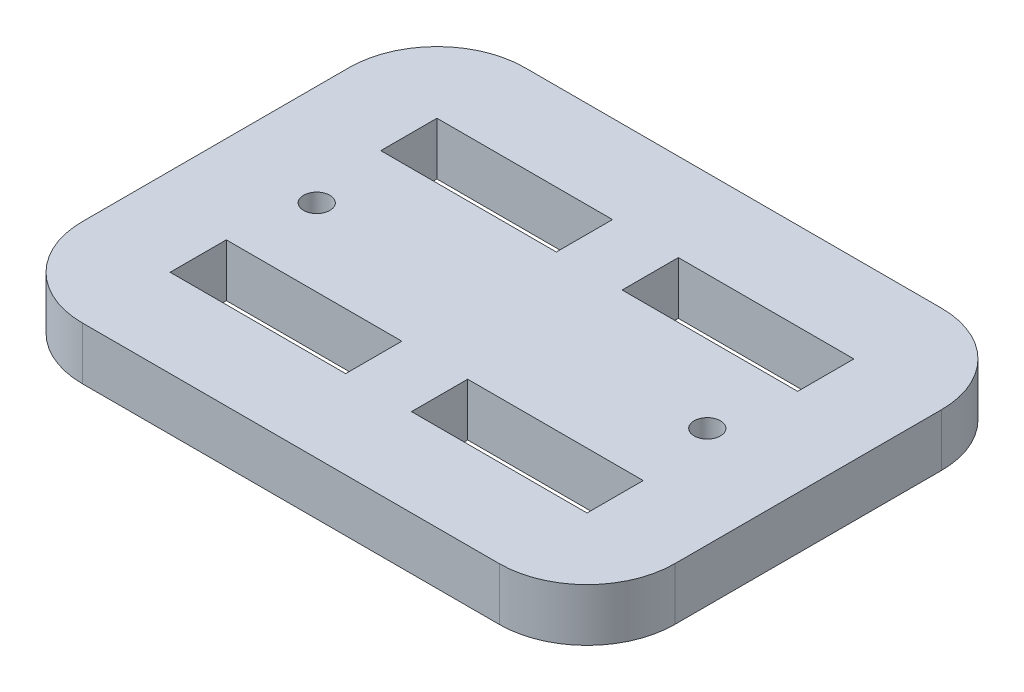
from build123d import *

# Parameters (mm, degrees)
SKETCH1_W            = 33.75
SKETCH1_H            = 50.4
SKETCH1_R            = 1.5
SKETCH1_W_2          = 20
SKETCH1_H_2          = 6.4
BOSS_EXTRUDE1_DEPTH  = 6
FILLET1_R            = 10
FILLET1_OF_MIRROR1_R = 10


with BuildPart() as part:
    # Sketch1 → Boss-Extrude1 (new body)
    with BuildSketch(Plane(origin=(0, 0, 0), x_dir=(1, 0, 0), z_dir=(0, 1, 0))):
        with Locations((-16.875, 0)):
            Rectangle(SKETCH1_W, SKETCH1_H)
        with Locations((-22.25, 0)):
            Circle(SKETCH1_R, mode=Mode.SUBTRACT)
        with Locations((-13.75, 12)):
            Rectangle(SKETCH1_W_2, SKETCH1_H_2, mode=Mode.SUBTRACT)
        with Locations((-13.75, -12)):
            Rectangle(SKETCH1_W_2, SKETCH1_H_2, mode=Mode.SUBTRACT)
    boss_extrude1 = extrude(amount=BOSS_EXTRUDE1_DEPTH)

    # Fillet1
    fillet1_edges = [part.edges().sort_by_distance(p)[0] for p in [
        (-33.75, 3, -25.2),
        (-33.75, 3, 25.2),
    ]]
    fillet(fillet1_edges, radius=FILLET1_R)

    # Mirror1: Boss-Extrude1 across plane
    add(boss_extrude1.mirror(Plane(origin=(0, 6, -25.2), x_dir=(0, 0, 1), z_dir=(-1, 0, 0))))

    # Fillet1 of Mirror1
    fillet1_of_mirror1_edges = [part.edges().sort_by_distance(p)[0] for p in [
        (33.75, 3, -25.2),
        (33.75, 3, 25.2),
    ]]
    fillet(fillet1_of_mirror1_edges, radius=FILLET1_OF_MIRROR1_R)


solid = part.part
